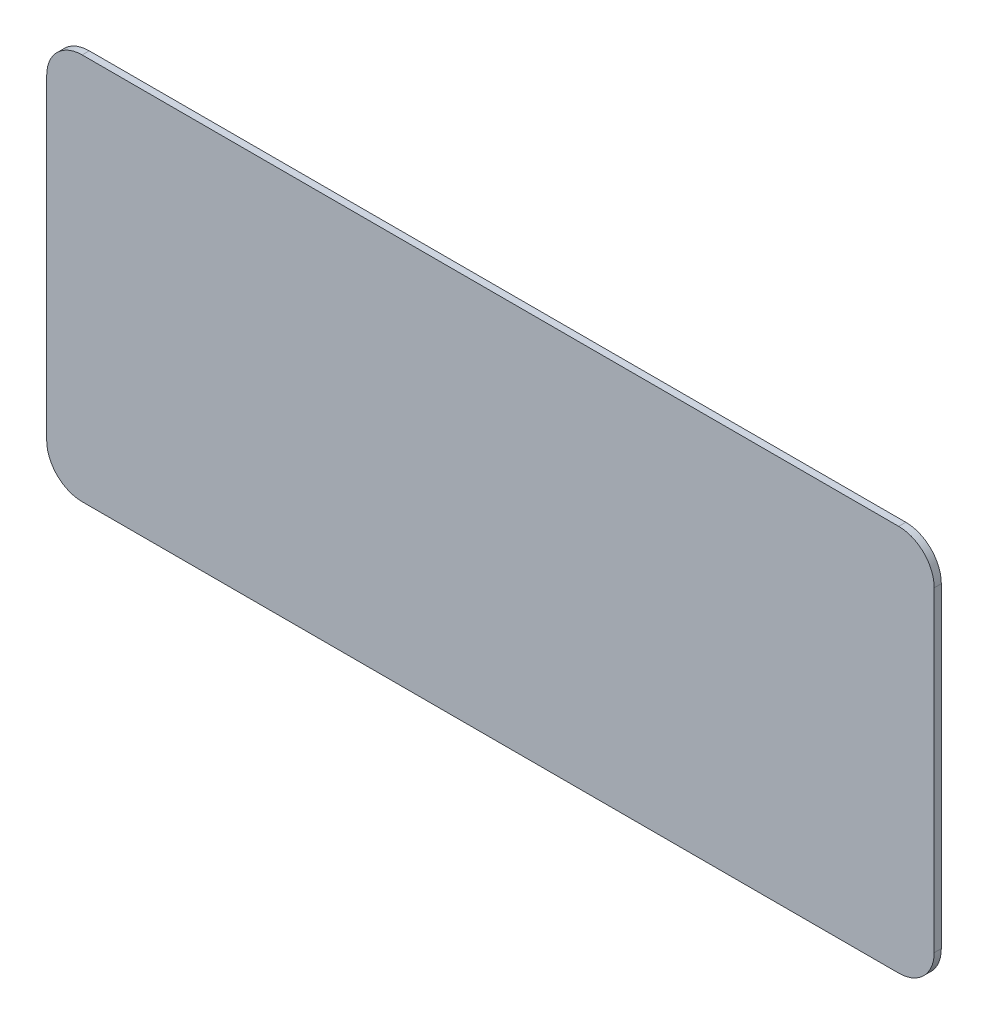
from build123d import *

# Parameters (mm, degrees)
SKETCH1_W           = 500
SKETCH1_H           = 218
BOSS_EXTRUDE1_DEPTH = 4
FILLET1_R           = 20


with BuildPart() as part:
    # Sketch1 → Boss-Extrude1 (new body)
    with BuildSketch(Plane.XY):
        Rectangle(SKETCH1_W, SKETCH1_H)
    extrude(amount=BOSS_EXTRUDE1_DEPTH)

    # Fillet1
    fillet1_edges = [part.edges().sort_by_distance(p)[0] for p in [
        (-250, -109, 2),
        (-250, 109, 2),
        (250, 109, 2),
        (250, -109, 2),
    ]]
    fillet(fillet1_edges, radius=FILLET1_R)


solid = part.part
